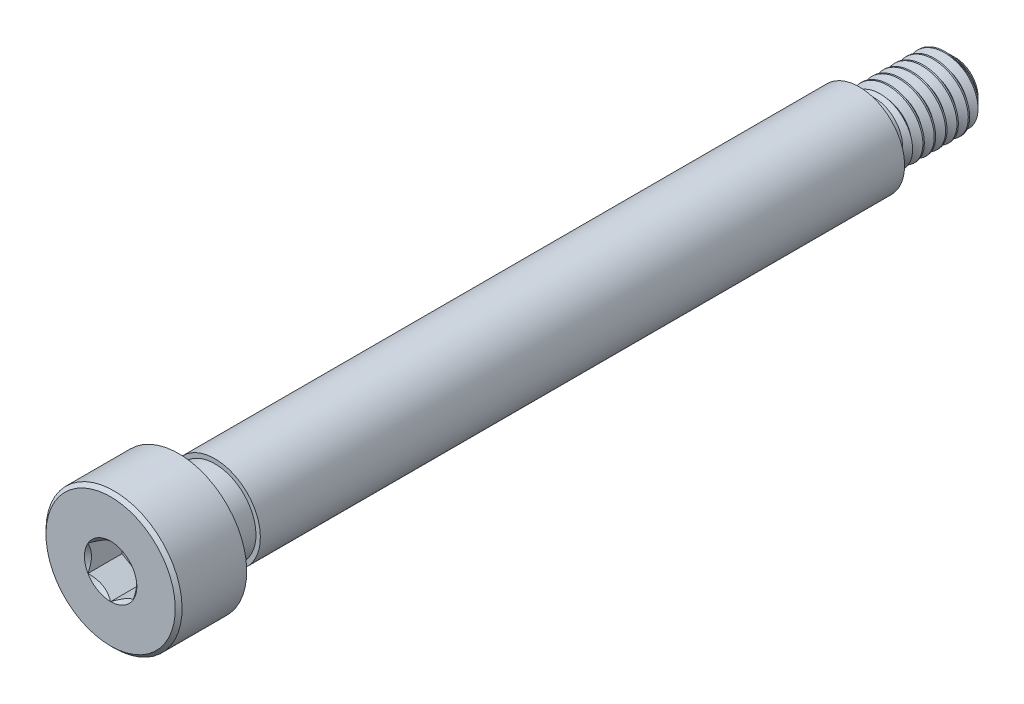
from build123d import *

# Parameters (mm, degrees)
CUT_REVOLVE_THIN1_START         = -14.379
CUT_REVOLVE_THIN1_OUTLINE_R     = 2
CUT_REVOLVE_THIN1_OUTLINE_R_2   = 1.807
CUT_REVOLVE_THIN1_DEPTH         = 28.4
CUT_REVOLVE_THIN1_2_OUTLINE_R   = 2
CUT_REVOLVE_THIN1_2_OUTLINE_R_2 = 1.797
CUT_REVOLVE_THIN1_2_DEPTH       = 28.4
CUT_EXTRUDE1_START              = 18.621
CUT_EXTRUDE1_DEPTH              = 1.5
CHAMFER2_SIZE                   = 0.506148016
CUT_SWEEP1_PITCH                = 0.5
CUT_SWEEP1_TO                   = 3.567136


with BuildPart() as part:
    # Sketch3 → Revolve1 (revolve)
    with BuildSketch(Plane(origin=(0, 0, 0), x_dir=(0, 0, -1), z_dir=(1, 0, 0)), mode=Mode.PRIVATE) as revolve1_sk:
        with BuildLine():
            Line((-18.621, 0), (-18.621, 2.805))
            Line((-18.621, 2.805), (-18.621, 3))
            Line((-18.621, 3), (-15.816, 3))
            Line((-15.816, 3), (-15.621, 3))
            Line((-15.621, 3), (-15.621, 1.797))
            Line((-15.621, 1.797), (-14.021, 1.797))
            Line((-14.021, 1.797), (-14.021, 2))
            Line((-14.021, 2), (14.379, 2))
            Line((14.379, 2), (14.379, 1.36904775))
            ThreePointArc((14.379, 1.36904775), (14.417355026, 1.276450526), (14.50995225, 1.2380955))
            Line((14.50995225, 1.2380955), (15.053864022, 1.2380955))
            Line((15.053864022, 1.2380955), (15.053864022, 1.5))
            Line((15.053864022, 1.5), (18.246, 1.5))
            Line((18.246, 1.5), (18.621, 1.5))
            Line((18.621, 1.5), (18.621, 0))
            Line((18.621, 0), (-18.621, 0))
        make_face()
    revolve(revolve1_sk.sketch.rotate(Axis((0, 0, 18.621), (0, 0, -1)), 180), axis=Axis((0, 0, 18.621), (0, 0, -1)))

    # Cut-Revolve-Thin1 2 outline → Cut-Revolve-Thin1 2 (cut)
    with BuildSketch(Plane.XY.offset(CUT_REVOLVE_THIN1_START)):
        Circle(CUT_REVOLVE_THIN1_2_OUTLINE_R)
        Circle(CUT_REVOLVE_THIN1_2_OUTLINE_R_2, mode=Mode.SUBTRACT)
    extrude(amount=CUT_REVOLVE_THIN1_2_DEPTH, mode=Mode.SUBTRACT)

    # Sketch4 → Cut-Extrude1 (cut)
    with BuildSketch(Plane.XY.offset(CUT_EXTRUDE1_START)):
        Polygon((0, 1.154700538), (-1, 0.577350269), (-1, -0.577350269), (0, -1.154700538), (1, -0.577350269), (1, 0.577350269), align=None)
    extrude(amount=-CUT_EXTRUDE1_DEPTH, mode=Mode.SUBTRACT)

    # Cut-Extrude2 cone 1 section (through the dimple's axis) → Cut-Extrude2 (revolve, cut)
    with BuildSketch(Plane(origin=(0, 0, 18.621), x_dir=(0, -1, 0), z_dir=(1, 0, 0))):
        Polygon((0, 0), (1.154700538, 0), (0, 1.154700538), align=None)
    revolve(axis=Axis((0, 0, 18.621), (0, 0, -1)), mode=Mode.SUBTRACT)

    # Chamfer2
    chamfer2_edges = [part.edges().sort_by_distance(p)[0] for p in [
        (0, 1.5, -18.621),
    ]]
    chamfer(chamfer2_edges, length=CHAMFER2_SIZE)

    # Sketch10 → Cut-Revolve2 (revolve, cut)
    with BuildSketch(Plane(origin=(0, 0, 0), x_dir=(0, 0, -1), z_dir=(1, 0, 0)), mode=Mode.PRIVATE) as cut_revolve2_sk:
        Polygon((-18.621, 2.85), (-18.471, 3), (-18.621, 3), align=None)
    revolve(cut_revolve2_sk.sketch.rotate(Axis((0, 0, 18.621), (0, 0, -1)), 180), axis=Axis((0, 0, 18.621), (0, 0, -1)), mode=Mode.SUBTRACT)


with BuildPart() as body_2:
    # Cut-Revolve-Thin1: read off the stored shape, not the designer's step
    # Cut-Revolve-Thin1 outline → Cut-Revolve-Thin1 (new body)
    with BuildSketch(Plane.XY.offset(CUT_REVOLVE_THIN1_START)):
        Circle(CUT_REVOLVE_THIN1_OUTLINE_R)
        Circle(CUT_REVOLVE_THIN1_OUTLINE_R_2, mode=Mode.SUBTRACT)
    extrude(amount=CUT_REVOLVE_THIN1_DEPTH)


with BuildPart() as body_3:
    # Split1: read off the stored shape, not the designer's step
    # Split1: the piece on the far side of the plane
    add(part.part)
    split(bisect_by=Plane.XY.offset(-15.053864022), keep=Keep.BOTTOM)

    # Cut-Sweep1: arcs per turn and ends read off the stored shape
    # Cut-Sweep1: the profile of Sketch7 screwed along a right-hand helix through 9 turns, 6 arcs to a turn; built about Z, then put on its axis
    cut_sweep1_z = Axis((0, 0, 0), (0, 0, 1))
    cut_sweep1_corners = [(1.527063294, 0, 0.015625), (1.175240474, 0, -0.1875), (1.175240474, 0, -0.25), (1.527063294, 0, -0.453125)]
    with BuildLine(mode=Mode.PRIVATE) as cut_sweep1_profile:
        Line(cut_sweep1_corners[0], cut_sweep1_corners[1])
        Line(cut_sweep1_corners[1], cut_sweep1_corners[2])
        Line(cut_sweep1_corners[2], cut_sweep1_corners[3])
        Line(cut_sweep1_corners[3], cut_sweep1_corners[0])
    cut_sweep1_cap = Face(cut_sweep1_profile.wire())
    cut_sweep1_turn_angles = [0, 30, 60, 90, 120, 150, 180, 210, 240, 270, 300, 330, 360]
    cut_sweep1_turn_weights = [1, 0.8660254037844387, 1, 0.8660254037844387, 1, 0.8660254037844387, 1, 0.8660254037844387, 1, 0.8660254037844387, 1, 0.8660254037844387, 1]
    cut_sweep1_turn_rails = [Edge.make_bspline([Vector(p[0], p[1], 0).rotate(cut_sweep1_z, cut_sweep1_turn_angles[k]) / cut_sweep1_turn_weights[k] + Vector(0, 0, p[2] + CUT_SWEEP1_PITCH * cut_sweep1_turn_angles[k] / 360) for k in range(13)], [0, 0, 0, 1, 1, 2, 2, 3, 3, 4, 4, 5, 5, 6, 6, 6], 2, cut_sweep1_turn_weights) for p in cut_sweep1_corners]
    cut_sweep1_turn_sides = [Face.make_surface_from_curves(cut_sweep1_turn_rails[p[0]], cut_sweep1_turn_rails[p[1]]) for p in [(0, 1), (1, 2), (2, 3), (3, 0)]]
    cut_sweep1 = Plane(origin=(0, 0, -18.621), x_dir=(0, 1, 0), z_dir=(0, 0, 1)) * split(Solid(Shell([*[p.moved(Location((0, 0, CUT_SWEEP1_PITCH * i))) for i in range(9) for p in cut_sweep1_turn_sides], cut_sweep1_cap, cut_sweep1_cap.rotate(cut_sweep1_z, 3240).moved(Location((0, 0, CUT_SWEEP1_PITCH * 3240 / 360)))])), bisect_by=Plane.XY.offset(CUT_SWEEP1_TO), keep=Keep.BOTTOM, mode=Mode.PRIVATE)
    add(cut_sweep1, mode=Mode.SUBTRACT)

    # Sketch11 → Cut-Revolve3 (revolve, cut)
    with BuildSketch(Plane(origin=(0, 0, 0), x_dir=(0, 0, -1), z_dir=(1, 0, 0)), mode=Mode.PRIVATE) as cut_revolve3_sk:
        with BuildLine():
            Line((15.053864022, 1.2380955), (14.50995225, 1.2380955))
            ThreePointArc((14.50995225, 1.2380955), (14.417355026, 1.276450526), (14.379, 1.36904775))
            Line((14.379, 1.36904775), (14.379, 1.5))
            Line((14.379, 1.5), (15.315768522, 1.5))
            Line((15.315768522, 1.5), (15.053864022, 1.2380955))
        make_face()
    revolve(cut_revolve3_sk.sketch.rotate(Axis((0, 0, 18.621), (0, 0, -1)), 180), axis=Axis((0, 0, 18.621), (0, 0, -1)), mode=Mode.SUBTRACT)


with BuildPart() as part_1:
    add(part.part)

    # Split1
    split(bisect_by=Plane.XY.offset(-15.053864022), keep=Keep.TOP)


with BuildPart() as body_3_1:
    add(body_3.part)

    # Combine1: union part
    add(part_1.part)


solid = Compound([body_2.part, body_3_1.part])
